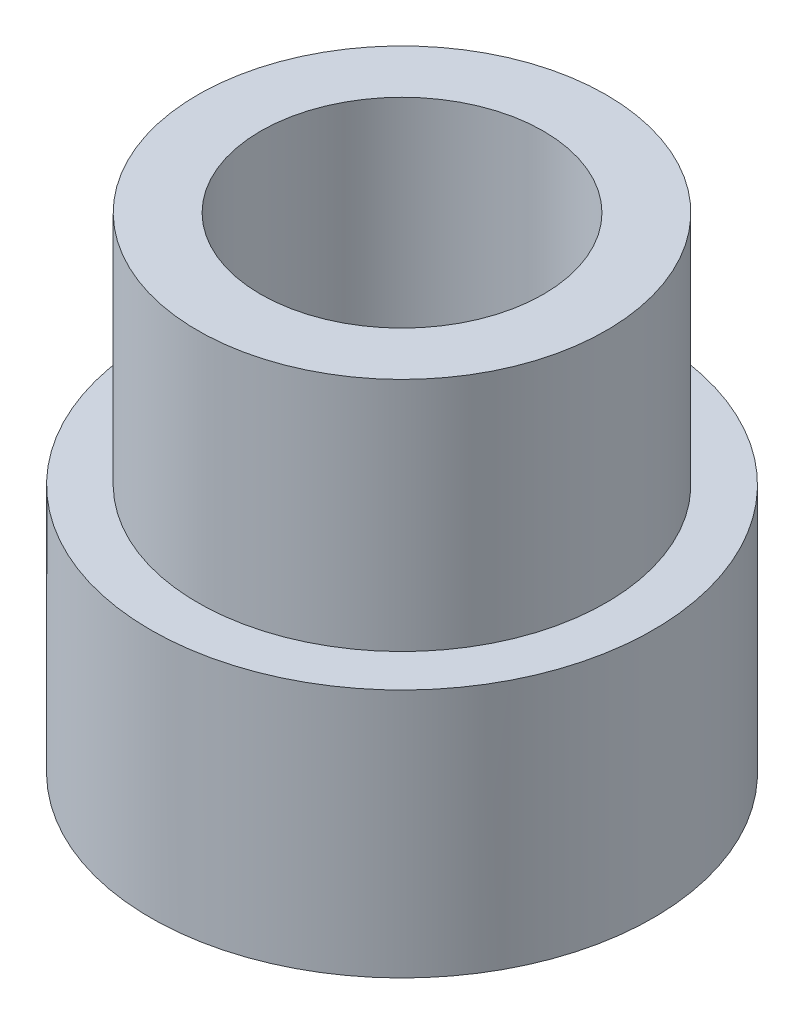
from build123d import *

# Parameters (mm, degrees)
SKETCH1_R           = 20.32
SKETCH1_R_2         = 4.6355
BOSS_EXTRUDE1_DEPTH = 10
SKETCH2_R           = 16.51
SKETCH2_R_2         = 11.43
BOSS_EXTRUDE2_DEPTH = 19.05
BOSS_EXTRUDE3_START = 10.16
SKETCH3_R           = 20.32
SKETCH3_R_2         = 4.6355
BOSS_EXTRUDE3_DEPTH = 10.16
CUT_EXTRUDE1_START  = -12
SKETCH4_R           = 11.43
CUT_EXTRUDE1_DEPTH  = 12
SKETCH5_R           = 8.5
CUT_EXTRUDE2_DEPTH  = 1.5


with BuildPart() as part:
    # Sketch1 → Boss-Extrude1 (new body)
    with BuildSketch(Plane(origin=(0, 0, 0), x_dir=(1, 0, 0), z_dir=(0, 1, 0))):
        Circle(SKETCH1_R)
        Circle(SKETCH1_R_2, mode=Mode.SUBTRACT)
    extrude(amount=BOSS_EXTRUDE1_DEPTH)

    # Sketch2 → Boss-Extrude2 (add)
    with BuildSketch(Plane(origin=(0, 10, 0), x_dir=(1, 0, 0), z_dir=(0, 1, 0))):
        Circle(SKETCH2_R)
        Circle(SKETCH2_R_2, mode=Mode.SUBTRACT)
    extrude(amount=BOSS_EXTRUDE2_DEPTH)

    # Sketch3 → Boss-Extrude3 (add)
    with BuildSketch(Plane(origin=(0, 0, 0), x_dir=(-1, 0, 0), z_dir=(0, -1, 0)).offset(BOSS_EXTRUDE3_START)):
        Circle(SKETCH3_R)
        Circle(SKETCH3_R_2, mode=Mode.SUBTRACT)
    extrude(amount=-BOSS_EXTRUDE3_DEPTH)

    # Sketch4 → Cut-Extrude1 (cut)
    with BuildSketch(Plane(origin=(0, 10, 0), x_dir=(1, 0, 0), z_dir=(0, 1, 0)).offset(CUT_EXTRUDE1_START)):
        Circle(SKETCH4_R)
    extrude(amount=CUT_EXTRUDE1_DEPTH, mode=Mode.SUBTRACT)

    # Sketch5 → Cut-Extrude2 (cut)
    with BuildSketch(Plane(origin=(0, -2, 0), x_dir=(1, 0, 0), z_dir=(0, 1, 0))):
        Circle(SKETCH5_R)
    extrude(amount=-CUT_EXTRUDE2_DEPTH, mode=Mode.SUBTRACT)


solid = part.part
